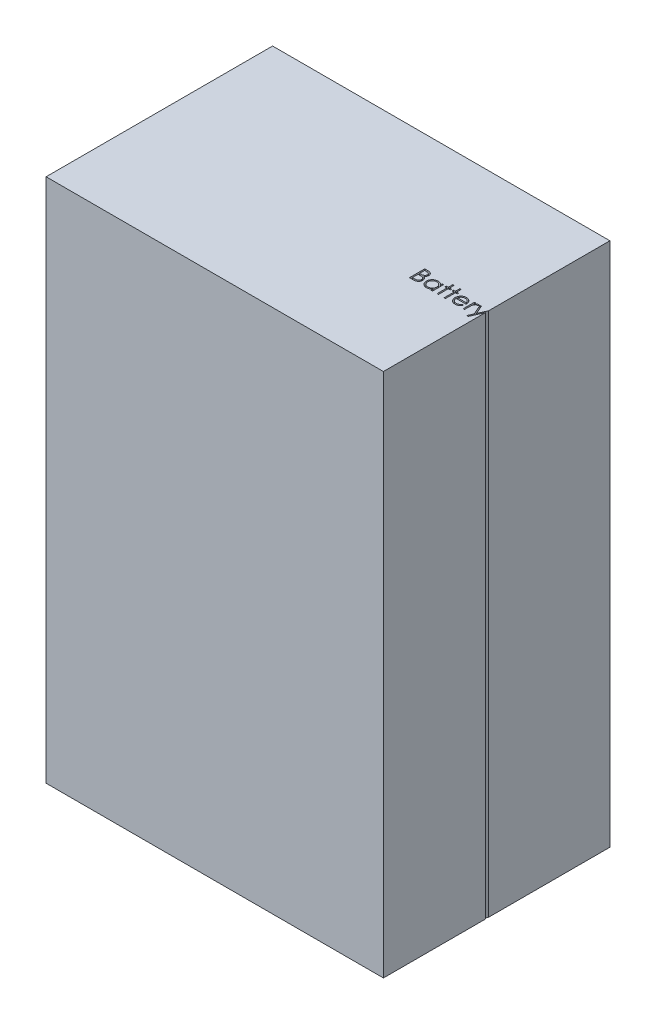
from build123d import *

# Parameters (mm, degrees)
SKETCH1_W      = 70
SKETCH1_H      = 109
EXTRUDE1_DEPTH = 23.5
EXTRUDE2_START = -54.5
EXTRUDE2_DEPTH = 109


# Read off the part's stored shape, not the designer's step: Extrude2
with BuildPart() as part:
    # Sketch1 → Extrude1 (new, symmetric)
    with BuildSketch(Plane.XY):
        Rectangle(SKETCH1_W, SKETCH1_H)
    extrude(amount=EXTRUDE1_DEPTH, both=True)

    # Extrude2 outline → Extrude2 (cut)
    # profile 1 of 7: a face of its own
    with BuildSketch(Plane(origin=(0, 0, 0), x_dir=(1, 0, 0), z_dir=(0, 1, 0)).offset(EXTRUDE2_START)):
        with BuildLine():
            add(Edge.make_bspline(
                [(21.45710085, -0.759237165), (21.487425255, -0.759396596), (21.546201499, -0.759705612), (21.631671993, -0.764498167), (21.711726271, -0.771032924), (21.78638755, -0.781401651), (21.85562133, -0.793912763), (21.919636258, -0.809063696), (21.978228772, -0.827230696), (22.04818104, -0.856119823), (22.127937639, -0.899048697), (22.214296181, -0.962483895), (22.288141456, -1.040074058), (22.351810472, -1.12759761), (22.402430059, -1.223877917), (22.439050779, -1.326620181), (22.462235423, -1.43449919), (22.464619788, -1.508561216), (22.465824808, -1.545990971)],
                knots=[0, 0, 0, 0, 0.062594097, 0.121322939, 0.176680142, 0.228365096, 0.276868446, 0.321879128, 0.364098625, 0.403355696, 0.477967948, 0.550535461, 0.623584457, 0.698174882, 0.77335367, 0.847281125, 0.92281834, 1, 1, 1, 1], degree=3))
            Line((21.45710085, -0.759237165), (20.83761968, -0.759237165))
            Line((20.83761968, -0.759237165), (20.83761968, -3.934237165))
            Line((20.83761968, -3.934237165), (21.696243478, -3.934237165))
            add(Edge.make_bspline(
                [(22.710055577, -3.033000186), (22.709169438, -3.06399442), (22.707425935, -3.124976443), (22.694562675, -3.214561458), (22.672782985, -3.300173017), (22.642782731, -3.382364861), (22.603628346, -3.460977983), (22.555977978, -3.536101444), (22.499162202, -3.606980444), (22.435605171, -3.674402588), (22.363703082, -3.735024938), (22.286128076, -3.789014186), (22.2019032, -3.833415257), (22.112411748, -3.870713362), (22.016649833, -3.899204178), (21.915047468, -3.919136441), (21.80769228, -3.932566725), (21.734023434, -3.933670903), (21.696243478, -3.934237165)],
                knots=[0, 0, 0, 0, 0.061160277, 0.120334558, 0.178180255, 0.235235126, 0.292682961, 0.351186248, 0.41045661, 0.471719854, 0.533761203, 0.595739024, 0.657887515, 0.72129518, 0.786822515, 0.854686154, 0.925477986, 1, 1, 1, 1], degree=3))
            add(Edge.make_bspline(
                [(22.098842636, -2.221441692), (22.134911024, -2.235289227), (22.203918785, -2.261782991), (22.298883954, -2.308623733), (22.380703563, -2.359570791), (22.450006688, -2.41520754), (22.509277275, -2.475177676), (22.561032444, -2.54036053), (22.605193404, -2.611606403), (22.643032985, -2.688172467), (22.672559357, -2.769276906), (22.694671784, -2.854158967), (22.707342256, -2.942514278), (22.709145331, -3.002644587), (22.710055577, -3.033000186)],
                knots=[0, 0, 0, 0, 0.106057493, 0.202914257, 0.290300165, 0.370222566, 0.446383721, 0.5213969, 0.598291083, 0.676142469, 0.7555287, 0.834887172, 0.916646049, 1, 1, 1, 1], degree=3))
            add(Edge.make_bspline(
                [(22.465824808, -1.545990971), (22.464833103, -1.581054361), (22.462884308, -1.649957228), (22.444249091, -1.750735456), (22.41507477, -1.846666919), (22.374520723, -1.937401511), (22.321813912, -2.020889146), (22.25934958, -2.097803309), (22.183987052, -2.164887482), (22.127523541, -2.202391401), (22.098842636, -2.221441692)],
                knots=[0, 0, 0, 0, 0.130569107, 0.256580609, 0.380551617, 0.503622917, 0.625739323, 0.747548582, 0.871766119, 1, 1, 1, 1], degree=3))
        make_face()
        with BuildLine():
            add(Edge.make_bspline(
                [(21.528334824, -3.608596139), (21.557380564, -3.608248025), (21.613362398, -3.607577082), (21.694189943, -3.605386736), (21.769104616, -3.600404458), (21.837764567, -3.592561437), (21.900911192, -3.584053844), (21.957786966, -3.57261361), (22.008852934, -3.559506339), (22.068066056, -3.539246054), (22.134744239, -3.507771398), (22.206599801, -3.460314921), (22.270486442, -3.403778778), (22.324738356, -3.338345734), (22.369200138, -3.267197316), (22.401544729, -3.191772606), (22.421493578, -3.113317878), (22.423908546, -3.059826646), (22.42511968, -3.033000186)],
                knots=[0, 0, 0, 0, 0.072502489, 0.139738989, 0.201795135, 0.259821934, 0.312205989, 0.360773434, 0.404540343, 0.443698099, 0.516840794, 0.587874336, 0.657965418, 0.728969389, 0.79930772, 0.866635778, 0.933116329, 1, 1, 1, 1], degree=3))
            Line((21.528334824, -3.608596139), (21.122555577, -3.608596139))
            Line((21.122555577, -3.608596139), (21.122555577, -2.428147421))
            Line((21.122555577, -2.428147421), (21.311452813, -2.428147421))
            add(Edge.make_bspline(
                [(21.905493277, -2.465672461), (21.890045455, -2.462538207), (21.856551389, -2.455742496), (21.801934512, -2.448569079), (21.73958126, -2.442178203), (21.66934765, -2.437450939), (21.591144822, -2.432564574), (21.504805761, -2.430664272), (21.410683054, -2.428397086), (21.345375687, -2.428232772), (21.311452813, -2.428147421)],
                knots=[0, 0, 0, 0, 0.079306486, 0.171952819, 0.277056507, 0.394730576, 0.526177321, 0.671344767, 0.829285257, 1, 1, 1, 1], degree=3))
            add(Edge.make_bspline(
                [(22.42511968, -3.033000186), (22.424869214, -3.016224084), (22.424372322, -2.98294248), (22.416878764, -2.93403313), (22.405980468, -2.886656802), (22.391891238, -2.840684852), (22.37137215, -2.796948432), (22.347417642, -2.754582539), (22.319331227, -2.713531168), (22.275566877, -2.661631481), (22.211910862, -2.601835334), (22.121462573, -2.543290599), (22.018617703, -2.496075803), (21.94402562, -2.476028421), (21.905493277, -2.465672461)],
                knots=[0, 0, 0, 0, 0.060287398, 0.119602355, 0.177503371, 0.235142664, 0.292132593, 0.350871209, 0.410097863, 0.470731522, 0.594828704, 0.722578824, 0.85669139, 1, 1, 1, 1], degree=3))
        make_face(mode=Mode.SUBTRACT)
        with BuildLine():
            add(Edge.make_bspline(
                [(21.313996883, -2.102506396), (21.341981148, -2.102143608), (21.396052449, -2.101442629), (21.474356927, -2.099434653), (21.547041765, -2.093812142), (21.613981499, -2.088191247), (21.675070716, -2.079052157), (21.730174076, -2.068173589), (21.780156375, -2.056668382), (21.83779582, -2.037101776), (21.90317628, -2.00818417), (21.972874882, -1.963306148), (22.034319722, -1.909853342), (22.086205742, -1.848175826), (22.128670433, -1.780261501), (22.158165018, -1.707193973), (22.178165054, -1.630794282), (22.179971658, -1.578344867), (22.18088891, -1.55171513)],
                knots=[0, 0, 0, 0, 0.072301034, 0.139700332, 0.202288511, 0.260599533, 0.313190329, 0.361738933, 0.405706476, 0.445539985, 0.518831956, 0.58977824, 0.658867479, 0.728430478, 0.797282704, 0.864815377, 0.931363753, 1, 1, 1, 1], degree=3))
            Line((21.313996883, -2.102506396), (21.122555577, -2.102506396))
            Line((21.122555577, -2.102506396), (21.122555577, -1.08487819))
            Line((21.122555577, -1.08487819), (21.509254295, -1.08487819))
            add(Edge.make_bspline(
                [(22.18088891, -1.55171513), (22.18041159, -1.53409318), (22.179475273, -1.499525801), (22.17180692, -1.449134601), (22.158773478, -1.401742054), (22.142032797, -1.356698682), (22.118638773, -1.315412933), (22.091094774, -1.276457319), (22.057815612, -1.241158469), (22.019935764, -1.208166138), (21.976385085, -1.178915745), (21.927189556, -1.153297339), (21.871683592, -1.132668206), (21.810802645, -1.11460141), (21.743609587, -1.101912029), (21.670879813, -1.091340742), (21.592017604, -1.085958897), (21.537457404, -1.085246461), (21.509254295, -1.08487819)],
                knots=[0, 0, 0, 0, 0.057003133, 0.111817869, 0.164402372, 0.215869805, 0.26684111, 0.317478963, 0.369902136, 0.423400449, 0.479718398, 0.539241497, 0.602430689, 0.671029546, 0.744484798, 0.823453971, 0.908740313, 1, 1, 1, 1], degree=3))
        make_face(mode=Mode.SUBTRACT)
    # profile 2 of 7: a face of its own
    with BuildSketch(Plane(origin=(0, 0, 0), x_dir=(1, 0, 0), z_dir=(0, 1, 0)).offset(EXTRUDE2_START)):
        with BuildLine():
            add(Edge.make_bspline(
                [(25.35588891, -3.532910041), (25.323759008, -3.569231673), (25.261057098, -3.640113794), (25.156335512, -3.732716908), (25.045330094, -3.809260099), (24.92857961, -3.871081809), (24.806189489, -3.917520317), (24.678431038, -3.950527761), (24.545252143, -3.971749312), (24.454308935, -3.973868417), (24.408222644, -3.974942293)],
                knots=[0, 0, 0, 0, 0.134298379, 0.262084975, 0.386269912, 0.507164597, 0.627300236, 0.748144942, 0.872370177, 1, 1, 1, 1], degree=3))
            Line((25.35588891, -3.532910041), (25.35588891, -3.934237165))
            Line((25.35588891, -3.934237165), (25.640824808, -3.934237165))
            Line((25.640824808, -3.934237165), (25.640824808, -1.614044857))
            Line((25.640824808, -1.614044857), (25.35588891, -1.614044857))
            Line((25.35588891, -1.614044857), (25.35588891, -2.043356756))
            add(Edge.make_bspline(
                [(24.417126891, -1.573339729), (24.464479621, -1.574643975), (24.557336088, -1.57720154), (24.693160782, -1.598485585), (24.821652558, -1.634443338), (24.943803292, -1.683354211), (25.059174343, -1.748349844), (25.166673479, -1.83033738), (25.267425739, -1.928799742), (25.32582786, -2.004428645), (25.35588891, -2.043356756)],
                knots=[0, 0, 0, 0, 0.129862142, 0.254653531, 0.376014554, 0.495255252, 0.614797719, 0.738105554, 0.8651963, 1, 1, 1, 1], degree=3))
            add(Edge.make_bspline(
                [(23.198517116, -2.767780835), (23.19965374, -2.727445904), (23.201900784, -2.647705921), (23.218640491, -2.530431673), (23.246790048, -2.417475822), (23.286294167, -2.309202024), (23.336950798, -2.205479264), (23.398571277, -2.106234184), (23.471160054, -2.011193374), (23.554846166, -1.922591618), (23.645501279, -1.840748632), (23.742482771, -1.769620427), (23.843378176, -1.708191571), (23.949752479, -1.659520203), (24.060031209, -1.620141944), (24.175196121, -1.592897752), (24.294768053, -1.576843753), (24.375948714, -1.57451896), (24.417126891, -1.573339729)],
                knots=[0, 0, 0, 0, 0.063774532, 0.12607881, 0.186904093, 0.247573935, 0.308003356, 0.369131898, 0.432033228, 0.496790794, 0.561610823, 0.624913866, 0.686726349, 0.748078833, 0.809582291, 0.871630743, 0.934885821, 1, 1, 1, 1], degree=3))
            add(Edge.make_bspline(
                [(24.408222644, -3.974942293), (24.367248858, -3.973829798), (24.286446736, -3.971635909), (24.167584645, -3.954615819), (24.053200961, -3.927283041), (23.943187599, -3.889272949), (23.838256438, -3.838853203), (23.737509065, -3.778490785), (23.641467409, -3.706608032), (23.55159537, -3.624431749), (23.468834912, -3.53517344), (23.396207901, -3.439972836), (23.335653321, -3.339241604), (23.285016534, -3.2342551), (23.246012707, -3.124205137), (23.218822339, -3.009472278), (23.201822076, -2.890192178), (23.199629094, -2.808967039), (23.198517116, -2.767780835)],
                knots=[0, 0, 0, 0, 0.064619991, 0.127433484, 0.189004127, 0.249930071, 0.310668454, 0.372328961, 0.43493911, 0.499575544, 0.564191208, 0.626735217, 0.688109334, 0.749293607, 0.810330528, 0.87190117, 0.935045915, 1, 1, 1, 1], degree=3))
        make_face()
        with BuildLine():
            add(Edge.make_bspline(
                [(24.420942997, -1.858275626), (24.379292133, -1.859757569), (24.297079953, -1.862682689), (24.176390037, -1.885518645), (24.060898583, -1.923513955), (23.951183216, -1.975476823), (23.848977048, -2.040817177), (23.757633503, -2.119848717), (23.676405482, -2.210415152), (23.608090128, -2.31210778), (23.552400177, -2.421126477), (23.513241512, -2.535085789), (23.487415838, -2.651930304), (23.484777394, -2.731180741), (23.483453013, -2.770960923)],
                knots=[0, 0, 0, 0, 0.085920517, 0.169593435, 0.252475515, 0.336244477, 0.419504521, 0.502035907, 0.584774648, 0.669846475, 0.754184866, 0.836658238, 0.918009726, 1, 1, 1, 1], degree=3))
            add(Edge.make_bspline(
                [(25.35588891, -2.779229152), (25.355018365, -2.747172691), (25.353304856, -2.684075433), (25.340214268, -2.591431185), (25.319390871, -2.502772733), (25.290048273, -2.418006865), (25.251502608, -2.337602244), (25.205013564, -2.260981547), (25.14976362, -2.188543277), (25.086642174, -2.12128492), (25.017549455, -2.059938057), (24.944438693, -2.005179068), (24.866443687, -1.960194967), (24.784876089, -1.92296467), (24.699594378, -1.893338156), (24.609904602, -1.873573605), (24.516760092, -1.860002457), (24.453218313, -1.858857297), (24.420942997, -1.858275626)],
                knots=[0, 0, 0, 0, 0.0656338, 0.129188088, 0.191218683, 0.251912818, 0.312507474, 0.373494434, 0.4351516, 0.498741474, 0.562095217, 0.624186567, 0.685475718, 0.746096815, 0.807611636, 0.869966581, 0.933951019, 1, 1, 1, 1], degree=3))
            add(Edge.make_bspline(
                [(24.418398926, -3.690006396), (24.459625397, -3.688500571), (24.541620757, -3.685505636), (24.662668728, -3.662571917), (24.780139159, -3.624681649), (24.892431859, -3.57215887), (24.997040063, -3.507064697), (25.090927424, -3.430858265), (25.170316909, -3.342227519), (25.237620205, -3.244821737), (25.290393619, -3.13804014), (25.328834758, -3.024344124), (25.35156223, -2.903729731), (25.354426742, -2.821303169), (25.35588891, -2.779229152)],
                knots=[0, 0, 0, 0, 0.084802388, 0.16866354, 0.252551924, 0.338239689, 0.423102661, 0.505556051, 0.586175656, 0.66713572, 0.74849918, 0.830452399, 0.913455706, 1, 1, 1, 1], degree=3))
            add(Edge.make_bspline(
                [(23.483453013, -2.770960923), (23.485144738, -2.810503377), (23.488521556, -2.889433293), (23.512788257, -3.006437102), (23.553500714, -3.120423269), (23.609056014, -3.230424313), (23.678621738, -3.332554175), (23.759256444, -3.424847001), (23.851739913, -3.504212556), (23.954181295, -3.570649497), (24.063589954, -3.624318356), (24.178646449, -3.661661472), (24.29718792, -3.685771315), (24.37778968, -3.688587519), (24.418398926, -3.690006396)],
                knots=[0, 0, 0, 0, 0.081589349, 0.162858895, 0.245483689, 0.330807139, 0.416493374, 0.499893203, 0.583048156, 0.667157852, 0.751311929, 0.833784789, 0.916256489, 1, 1, 1, 1], degree=3))
        make_face(mode=Mode.SUBTRACT)
    # profile 3 of 7: a face of its own
    with BuildSketch(Plane(origin=(0, 0, 0), x_dir=(1, 0, 0), z_dir=(0, 1, 0)).offset(EXTRUDE2_START)):
        with BuildLine():
            add(Edge.make_bspline(
                [(30.272941194, -3.690006396), (30.301381164, -3.689454801), (30.357811519, -3.688360332), (30.441850011, -3.677717813), (30.524526582, -3.660509063), (30.605499046, -3.637023144), (30.683124027, -3.608378428), (30.755011062, -3.573813693), (30.821123829, -3.535577851), (30.882915649, -3.491844789), (30.942851479, -3.438315933), (31.002307877, -3.371517815), (31.066058841, -3.292516986), (31.105963686, -3.233057704), (31.127112869, -3.201544857)],
                knots=[0, 0, 0, 0, 0.082592263, 0.163878894, 0.24565874, 0.327725695, 0.408609961, 0.485749086, 0.559169056, 0.630268476, 0.705306028, 0.792064966, 0.889796437, 1, 1, 1, 1], degree=3))
            add(Edge.make_bspline(
                [(29.426401731, -2.835198703), (29.427798374, -2.865769839), (29.430544816, -2.925886744), (29.443349267, -3.013853097), (29.463532084, -3.097648914), (29.49189759, -3.176645674), (29.526248229, -3.251875147), (29.5683267, -3.32277928), (29.618527581, -3.389035117), (29.674521609, -3.451235306), (29.736848759, -3.506626139), (29.802419537, -3.556203108), (29.872172985, -3.597755327), (29.945559104, -3.631482799), (30.022459223, -3.657886386), (30.102897572, -3.675909337), (30.186715863, -3.687980784), (30.243852922, -3.689323052), (30.272941194, -3.690006396)],
                knots=[0, 0, 0, 0, 0.068384615, 0.134475588, 0.198391058, 0.260753477, 0.321829223, 0.383037238, 0.444653123, 0.507398011, 0.569825238, 0.630777641, 0.690928687, 0.750945133, 0.811049477, 0.872330853, 0.935004094, 1, 1, 1, 1], degree=3))
            Line((29.426401731, -2.835198703), (31.502363269, -2.835198703))
            add(Edge.make_bspline(
                [(31.249864271, -2.030000386), (31.269936565, -2.057399349), (31.309947546, -2.1120149), (31.360064558, -2.201070164), (31.403568766, -2.294243346), (31.438342238, -2.393040544), (31.4664995, -2.496291163), (31.486871043, -2.604733328), (31.498817768, -2.718334748), (31.501166086, -2.795738123), (31.502363269, -2.835198703)],
                knots=[0, 0, 0, 0, 0.11852184, 0.236254763, 0.356174434, 0.477249655, 0.601539871, 0.729618382, 0.862158266, 1, 1, 1, 1], degree=3))
            add(Edge.make_bspline(
                [(30.315554375, -1.573339729), (30.363131846, -1.574568045), (30.456467997, -1.57697772), (30.592568564, -1.599317323), (30.721347214, -1.634743569), (30.842752415, -1.684775936), (30.956796474, -1.749327815), (31.062738105, -1.829285057), (31.16238912, -1.922192893), (31.220363331, -1.993642376), (31.249864271, -2.030000386)],
                knots=[0, 0, 0, 0, 0.132040234, 0.259032841, 0.381879824, 0.502258444, 0.62275219, 0.744742632, 0.870108927, 1, 1, 1, 1], degree=3))
            add(Edge.make_bspline(
                [(29.408593237, -2.005831716), (29.437356635, -1.971479241), (29.49397228, -1.90386249), (29.589726974, -1.815018438), (29.69341358, -1.740593013), (29.803732698, -1.678900825), (29.9219665, -1.632025445), (30.046525642, -1.597093567), (30.178828424, -1.577519229), (30.269275303, -1.574754408), (30.315554375, -1.573339729)],
                knots=[0, 0, 0, 0, 0.128835254, 0.253589335, 0.374643257, 0.495340042, 0.616324775, 0.739759335, 0.86684232, 1, 1, 1, 1], degree=3))
            add(Edge.make_bspline(
                [(29.141465834, -2.780501187), (29.142426626, -2.744855162), (29.14433079, -2.674209449), (29.156333004, -2.569647133), (29.177603956, -2.468021323), (29.206792478, -2.369247574), (29.244485394, -2.273491266), (29.290597479, -2.180694123), (29.345200564, -2.090954889), (29.387357919, -2.034346332), (29.408593237, -2.005831716)],
                knots=[0, 0, 0, 0, 0.128044808, 0.2537679, 0.377428427, 0.500550841, 0.623295883, 0.746578332, 0.872347541, 1, 1, 1, 1], degree=3))
            add(Edge.make_bspline(
                [(30.308558181, -3.974942293), (30.263979387, -3.973901641), (30.177019075, -3.971871631), (30.05043659, -3.954370609), (29.931256689, -3.925820684), (29.819486073, -3.885937657), (29.715398458, -3.83384287), (29.618786968, -3.770379626), (29.529143541, -3.695873938), (29.449293008, -3.60968045), (29.377407486, -3.517440389), (29.313974778, -3.421323265), (29.260945537, -3.321570911), (29.217808526, -3.218818364), (29.182969827, -3.113713261), (29.158688603, -3.005299287), (29.144691618, -2.893869864), (29.142546728, -2.818488709), (29.141465834, -2.780501187)],
                knots=[0, 0, 0, 0, 0.071578658, 0.139629225, 0.204796697, 0.268134963, 0.329813747, 0.391301398, 0.453433515, 0.51655169, 0.579631271, 0.641118921, 0.701294047, 0.760810336, 0.819931722, 0.878919575, 0.938982822, 1, 1, 1, 1], degree=3))
            add(Edge.make_bspline(
                [(31.380247885, -3.334472541), (31.360076116, -3.370253278), (31.320829843, -3.439868421), (31.253337736, -3.53551018), (31.182587784, -3.621550608), (31.105386328, -3.69569108), (31.024043119, -3.760326265), (30.938107068, -3.816875577), (30.847130783, -3.865061664), (30.751109961, -3.9056586), (30.649238226, -3.936872927), (30.541268707, -3.958920327), (30.426994565, -3.972548578), (30.348666245, -3.97413167), (30.308558181, -3.974942293)],
                knots=[0, 0, 0, 0, 0.093369857, 0.181660766, 0.265874227, 0.346354784, 0.424599862, 0.501903184, 0.579992091, 0.658443431, 0.738672236, 0.821894148, 0.908800792, 1, 1, 1, 1], degree=3))
            Line((31.380247885, -3.334472541), (31.127112869, -3.201544857))
        make_face()
        with BuildLine():
            add(Edge.make_bspline(
                [(31.217427372, -2.550262806), (31.206998291, -2.512468628), (31.186925668, -2.439727), (31.14498268, -2.33899705), (31.097746354, -2.249473025), (31.04184664, -2.171840072), (30.978511082, -2.102894028), (30.905354381, -2.042642883), (30.823316106, -1.988742767), (30.732820314, -1.943247285), (30.636988123, -1.904521485), (30.536652506, -1.878554416), (30.43427437, -1.860765759), (30.365028267, -1.859109218), (30.330182781, -1.858275626)],
                knots=[0, 0, 0, 0, 0.096240125, 0.185231261, 0.267500523, 0.344400382, 0.419594869, 0.496890627, 0.576637919, 0.660267852, 0.745386615, 0.830040327, 0.914474212, 1, 1, 1, 1], degree=3))
            Line((31.217427372, -2.550262806), (29.45629456, -2.550262806))
            add(Edge.make_bspline(
                [(29.73232621, -2.075793655), (29.717183019, -2.089486356), (29.68653689, -2.117197045), (29.645587988, -2.164939253), (29.606380845, -2.216421028), (29.570699603, -2.273611962), (29.537972078, -2.335860812), (29.507346956, -2.402642524), (29.479782139, -2.474463863), (29.464273525, -2.524513147), (29.45629456, -2.550262806)],
                knots=[0, 0, 0, 0, 0.109983845, 0.222580497, 0.338499871, 0.458708565, 0.585535346, 0.717517743, 0.85466682, 1, 1, 1, 1], degree=3))
            add(Edge.make_bspline(
                [(30.330182781, -1.858275626), (30.301744361, -1.8588305), (30.245527586, -1.859927368), (30.162704474, -1.870332414), (30.083166461, -1.887531702), (30.006326664, -1.911085627), (29.93319202, -1.942480573), (29.862258194, -1.979295357), (29.795328835, -2.024236651), (29.753472088, -2.058489327), (29.73232621, -2.075793655)],
                knots=[0, 0, 0, 0, 0.131091976, 0.259141276, 0.384161763, 0.505991952, 0.629098089, 0.750669123, 0.874038938, 1, 1, 1, 1], degree=3))
        make_face(mode=Mode.SUBTRACT)
    # profile 4 of 7: a face of its own
    with BuildSketch(Plane(origin=(0, 0, 0), x_dir=(1, 0, 0), z_dir=(0, 1, 0)).offset(EXTRUDE2_START)):
        with BuildLine():
            add(Edge.make_bspline(
                [(32.275760705, -1.955586323), (32.296796222, -1.923785679), (32.337026485, -1.862967194), (32.403894642, -1.782531471), (32.47238695, -1.715933536), (32.542831298, -1.662862487), (32.615745717, -1.623117729), (32.689529952, -1.594004761), (32.765344843, -1.576789626), (32.816291731, -1.574491235), (32.841816394, -1.573339729)],
                knots=[0, 0, 0, 0, 0.160059412, 0.306112383, 0.438366514, 0.560541455, 0.675317225, 0.786113634, 0.892841788, 1, 1, 1, 1], degree=3))
            Line((32.275760705, -1.955586323), (32.275760705, -1.614044857))
            Line((32.275760705, -1.614044857), (31.990824808, -1.614044857))
            Line((31.990824808, -1.614044857), (31.990824808, -3.934237165))
            Line((31.990824808, -3.934237165), (32.275760705, -3.934237165))
            Line((32.275760705, -3.934237165), (32.275760705, -3.154479553))
            add(Edge.make_bspline(
                [(32.326642116, -2.358185482), (32.322349159, -2.376579775), (32.312840586, -2.417321737), (32.303595405, -2.485673613), (32.294460914, -2.566430789), (32.288023267, -2.659818055), (32.282056043, -2.765602201), (32.278690468, -2.88394438), (32.275875477, -3.014966063), (32.275800123, -3.106564226), (32.275760705, -3.154479553)],
                knots=[0, 0, 0, 0, 0.070854869, 0.15693815, 0.258600395, 0.37589093, 0.508166168, 0.656237809, 0.82017677, 1, 1, 1, 1], degree=3))
            add(Edge.make_bspline(
                [(32.787754896, -1.858275626), (32.764889695, -1.85979966), (32.718251313, -1.862908248), (32.649776088, -1.887345595), (32.583330409, -1.926829205), (32.530560401, -1.970618), (32.489700643, -2.012843502), (32.460544867, -2.04971741), (32.433799804, -2.09106374), (32.408245389, -2.136175667), (32.384962394, -2.185823456), (32.363232087, -2.239511085), (32.343584404, -2.297300738), (32.332380968, -2.337562024), (32.326642116, -2.358185482)],
                knots=[0, 0, 0, 0, 0.093806529, 0.191338128, 0.295190617, 0.410312337, 0.471930251, 0.536425159, 0.603118728, 0.674117672, 0.749332023, 0.828283384, 0.912039809, 1, 1, 1, 1], degree=3))
            add(Edge.make_bspline(
                [(32.933402933, -1.899616772), (32.919696892, -1.893502388), (32.893680203, -1.881896116), (32.855621418, -1.86816015), (32.82053192, -1.86007214), (32.798176692, -1.858846847), (32.787754896, -1.858275626)],
                knots=[0, 0, 0, 0, 0.295138801, 0.560229945, 0.794983357, 1, 1, 1, 1], degree=3))
            Line((32.933402933, -1.899616772), (33.089863269, -1.652841932))
            add(Edge.make_bspline(
                [(32.841816394, -1.573339729), (32.861615991, -1.574419707), (32.902354946, -1.576641831), (32.964024867, -1.592254508), (33.027564284, -1.617180999), (33.068514878, -1.640621773), (33.089863269, -1.652841932)],
                knots=[0, 0, 0, 0, 0.225277548, 0.463523195, 0.720323555, 1, 1, 1, 1], degree=3))
        make_face()
    # profile 5 of 7: a face of its own
    with BuildSketch(Plane(origin=(0, 0, 0), x_dir=(1, 0, 0), z_dir=(0, 1, 0)).offset(EXTRUDE2_START)):
        Polygon((26.577042757, -3.934237165), (26.861978654, -3.934237165), (26.861978654, -1.898980755), (27.269029936, -1.898980755), (27.269029936, -1.614044857), (26.861978654, -1.614044857), (26.861978654, -0.677826908), (26.577042757, -0.677826908), (26.577042757, -1.614044857), (26.169991475, -1.614044857), (26.169991475, -1.898980755), (26.577042757, -1.898980755), align=None)
    # profile 6 of 7: a face of its own
    with BuildSketch(Plane(origin=(0, 0, 0), x_dir=(1, 0, 0), z_dir=(0, 1, 0)).offset(EXTRUDE2_START)):
        Polygon((28.042427372, -3.934237165), (28.327363269, -3.934237165), (28.327363269, -1.898980755), (28.734414551, -1.898980755), (28.734414551, -1.614044857), (28.327363269, -1.614044857), (28.327363269, -0.677826908), (28.042427372, -0.677826908), (28.042427372, -1.614044857), (27.63537609, -1.614044857), (27.63537609, -1.898980755), (28.042427372, -1.898980755), align=None)
    # profile 7 of 7: a face of its own
    with BuildSketch(Plane(origin=(0, 0, 0), x_dir=(1, 0, 0), z_dir=(0, 1, 0)).offset(EXTRUDE2_START)):
        Polygon((33.437764912, -1.614044857), (33.130568398, -1.614044857), (34.068694399, -3.736435682), (33.596133301, -4.789044857), (33.903965834, -4.789044857), (35, -2.346454429), (35, -1.660417211), (34.223246683, -3.39107811), align=None)
    extrude(amount=EXTRUDE2_DEPTH, mode=Mode.SUBTRACT)


solid = part.part
